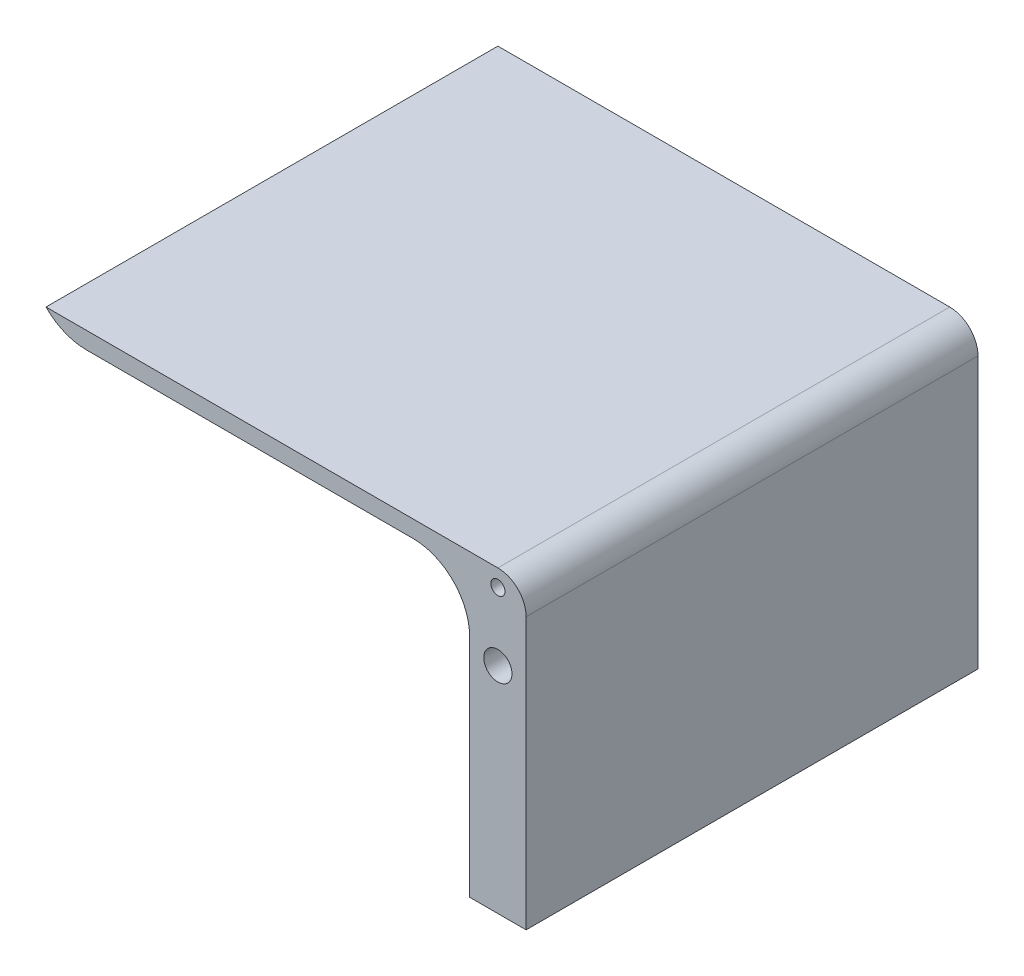
from build123d import *

# Parameters (mm, degrees)
RESSALTO_EXTRUS_O1_DEPTH = 80
ESBO_O3_R                = 2.5
CORTE_EXTRUS_O2_DEPTH    = 10
ESBO_O4_R                = 1.25
CORTE_EXTRUS_O3_DEPTH    = 10
FILETE1_R                = 10
FILETE2_R                = 5
FILETE3_R                = 10


with BuildPart() as part:
    # Esboço1 → Ressalto-extrusão1 (new body)
    with BuildSketch(Plane.XY):
        Polygon((-78.698181647, 27.74137931), (6.301818353, 27.74137931), (6.301818353, 24.74137931), (6.301818353, -25.25862069), (-3.698181647, -25.25862069), (-3.698181647, 24.74137931), (-78.698181647, 24.74137931), align=None)
    extrude(amount=RESSALTO_EXTRUS_O1_DEPTH)

    # Esboço3 → Corte-extrusão2 (cut)
    with BuildSketch(Plane.XY.offset(80)):
        with Locations((1.301818353, 12.74137931)):
            Circle(ESBO_O3_R)
    extrude(amount=-CORTE_EXTRUS_O2_DEPTH, mode=Mode.SUBTRACT)

    # Esboço4 → Corte-extrusão3 (cut)
    with BuildSketch(Plane.XY.offset(80)):
        with Locations((1.301818353, 24.74137931)):
            Circle(ESBO_O4_R)
    extrude(amount=-CORTE_EXTRUS_O3_DEPTH, mode=Mode.SUBTRACT)

    # Filete1
    filete1_edges = [part.edges().sort_by_distance(p)[0] for p in [
        (-3.698181647, 24.74137931, 40),
    ]]
    fillet(filete1_edges, radius=FILETE1_R)

    # Filete2
    filete2_edges = [part.edges().sort_by_distance(p)[0] for p in [
        (6.301818353, 27.74137931, 40),
    ]]
    fillet(filete2_edges, radius=FILETE2_R)

    # Filete3
    # the kernel refuses this fillet: 10 mm, written as the material it takes off along each edge
    with BuildSketch(Plane(origin=(-78.698181647, 24.74137931, -17.853571071), x_dir=(0, 1, 0), z_dir=(0, 0, 1))) as filete3_piece_1:
        with BuildLine():
            CenterArc((10, -7.141428429), FILETE3_R, 134.427004001, 45.572995999)
            Line((0, -7.141428429), (-0.2, -7.141428429))
            Line((-0.2, -7.141428429), (-0.2, 0))
            Line((-0.2, 0), (0, 0.2))
            ThreePointArc((0, 0.2), (1.5, 0.2), (2.86, 0.142828569))
            Line((2.86, 0.142828569), (3, 0))
        make_face()
    extrude(amount=115.707142143, mode=Mode.SUBTRACT)


solid = part.part
